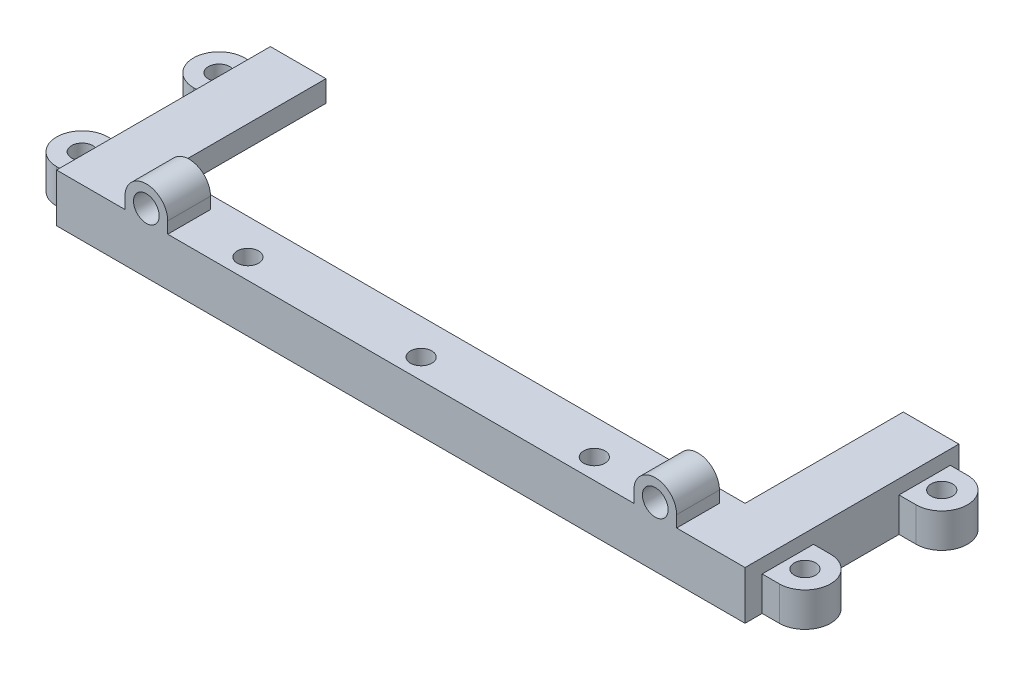
from build123d import *

# Parameters (mm, degrees)
CROQUIS4_W                = 13
CROQUIS4_H                = 11.3
SALIENTE_EXTRUIR1_DEPTH   = 161
CROQUIS5_W                = 151
CROQUIS5_H                = 3.5
CORTAR_EXTRUIR1_DEPTH     = 6.3
SALIENTE_EXTRUIR2_DEPTH   = 10
CROQUIS7_R                = 3
CORTAR_EXTRUIR2_DEPTH     = 170.652586187
SALIENTE_EXTRUIR3_DEPTH   = 8
CROQUIS9_R                = 2.5
CORTAR_EXTRUIR3_DEPTH     = 180.17031004
SIMETR_A8_COPY_1_DEPTH    = 8
SIMETR_A8_COPY_2_SKETCH_R = 2.5
SIMETR_A8_COPY_2_DEPTH    = 180.17031004
CROQUIS10_R               = 2.5
CORTAR_EXTRUIR4_DEPTH     = 179.518038304
MATRIZL1_COUNT            = 3
MATRIZL1_PITCH            = 40.5


with BuildPart() as part:
    # Barrer1: sweep along a path in Croquis3
    with BuildLine(Plane(origin=(0, 0, 0), x_dir=(1, 0, 0), z_dir=(0, 1, 0))) as barrer1_path:
        Line((0, 0), (0, -37))
    # Croquis1 → Barrer1 (sweep)
    with BuildSketch(Plane.XY):
        Polygon((0, 0), (0, 11.3), (13, 11.3), (13, 6.3), (5, 6.3), (5, 0), align=None)
    barrer1 = sweep(path=barrer1_path.line)

    # Croquis4 → Saliente-Extruir1 (add)
    with BuildSketch(Plane.ZY):
        with Locations((43.5, 5.65)):
            Rectangle(CROQUIS4_W, CROQUIS4_H)
    extrude(amount=-SALIENTE_EXTRUIR1_DEPTH)

    # Simetría5: Barrer1 across plane
    add(barrer1.mirror(Plane.ZY.offset(-80.5)))

    # Croquis5 → Cortar-Extruir1 (cut)
    with BuildSketch(Plane.XZ):
        with Locations((80.5, 38.75)):
            Rectangle(CROQUIS5_W, CROQUIS5_H)
    extrude(amount=-CORTAR_EXTRUIR1_DEPTH, mode=Mode.SUBTRACT)

    # Croquis6 → Saliente-Extruir2 (add)
    with BuildSketch(Plane.XY.offset(50)):
        with BuildLine():
            Line((16, 11.3), (26, 11.3))
            Line((26, 11.3), (26, 14))
            ThreePointArc((26, 14), (21, 19), (16, 14))
            Line((16, 14), (16, 11.3))
        make_face()
    saliente_extruir2 = extrude(amount=-SALIENTE_EXTRUIR2_DEPTH)

    # Croquis7 → Cortar-Extruir2 (cut, through all)
    with BuildSketch(Plane.XY.offset(50)):
        with Locations((21, 14)):
            Circle(CROQUIS7_R)
    cortar_extruir2 = extrude(amount=-CORTAR_EXTRUIR2_DEPTH, mode=Mode.SUBTRACT)

    # Simetría6: Saliente-Extruir2, Cortar-Extruir2 across plane
    add(saliente_extruir2.mirror(Plane.ZY.offset(-80.5)))
    add(cortar_extruir2.mirror(Plane.ZY.offset(-80.5)), mode=Mode.SUBTRACT)

    # Croquis8 → Saliente-Extruir3 (add)
    with BuildSketch(Plane.XZ):
        with BuildLine():
            Line((161, 46), (165, 46))
            ThreePointArc((165, 46), (171, 40), (165, 34))
            Line((165, 34), (161, 34))
            Line((161, 34), (161, 46))
        make_face()
    saliente_extruir3 = extrude(amount=-SALIENTE_EXTRUIR3_DEPTH)

    # Croquis9 → Cortar-Extruir3 (cut, through all)
    with BuildSketch(Plane.XZ):
        with Locations((165, 40)):
            Circle(CROQUIS9_R)
    cortar_extruir3 = extrude(amount=-CORTAR_EXTRUIR3_DEPTH, mode=Mode.SUBTRACT)

    # Simetría7: Saliente-Extruir3, Cortar-Extruir3 across plane
    add(saliente_extruir3.mirror(Plane(origin=(0, 0, 24), x_dir=(1, 0, 0), z_dir=(0, 0, -1))))
    add(cortar_extruir3.mirror(Plane(origin=(0, 0, 24), x_dir=(1, 0, 0), z_dir=(0, 0, -1))), mode=Mode.SUBTRACT)

    # Simetría8: Saliente-Extruir3, Cortar-Extruir3 across plane
    add(saliente_extruir3.mirror(Plane.ZY.offset(-80.5)))
    add(cortar_extruir3.mirror(Plane.ZY.offset(-80.5)), mode=Mode.SUBTRACT)

    # Simetría8 copy 1 sketch → Simetría8 copy 1 (add)
    with BuildSketch(Plane(origin=(161, 0, 48), x_dir=(-1, 0, 0), z_dir=(0, -1, 0))):
        with BuildLine():
            Line((161, 46), (165, 46))
            ThreePointArc((165, 46), (171, 40), (165, 34))
            Line((165, 34), (161, 34))
            Line((161, 34), (161, 46))
        make_face()
    extrude(amount=-SIMETR_A8_COPY_1_DEPTH)

    # Simetría8 copy 2 sketch → Simetría8 copy 2 (cut, through all)
    with BuildSketch(Plane(origin=(161, 0, 48), x_dir=(-1, 0, 0), z_dir=(0, -1, 0))):
        with Locations((165, 40)):
            Circle(SIMETR_A8_COPY_2_SKETCH_R)
    extrude(amount=-SIMETR_A8_COPY_2_DEPTH, mode=Mode.SUBTRACT)

    # Croquis10 → Cortar-Extruir4 (cut, through all)
    with BuildSketch(Plane(origin=(0, 11.3, 0), x_dir=(1, 0, 0), z_dir=(0, 1, 0))):
        with Locations((121, -45.25)):
            Circle(CROQUIS10_R)
    cortar_extruir4 = extrude(amount=-CORTAR_EXTRUIR4_DEPTH, mode=Mode.SUBTRACT)

    # MatrizL1: Cortar-Extruir4 ×3
    with Locations(*[(-i * MATRIZL1_PITCH, 0, 0) for i in range(1, MATRIZL1_COUNT)]):
        add(cortar_extruir4, mode=Mode.SUBTRACT)


solid = part.part
